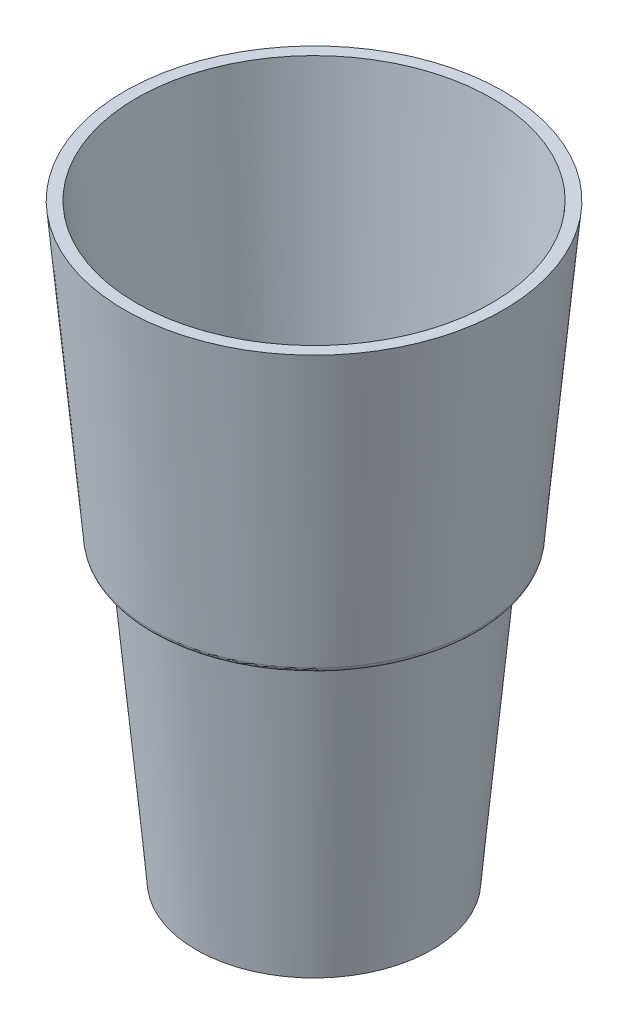
from build123d import *

# Parameters (mm, degrees)
FILLET1_R = 1.27
SHELL1_T  = -2.54


with BuildPart() as part:
    # Sketch1 → Revolve2 (revolve)
    with BuildSketch(Plane.XY):
        Polygon((0, 0), (25.4, 0), (31.185877256, 63.5), (34.995877256, 63.5), (40.781754513, 127), (0, 127), align=None)
    revolve(axis=Axis((0, 0, 0), (0, 1, 0)))

    # Fillet1
    fillet1_edges = [part.edges().sort_by_distance(p)[0] for p in [
        (-34.995877256, 63.5, 0),
        (-31.185877256, 63.5, 0),
    ]]
    fillet(fillet1_edges, radius=FILLET1_R)

    # Shell1
    shell1_openings = [part.faces().sort_by_distance(p)[0] for p in [
        (0, 127, 0),
    ]]
    offset(amount=SHELL1_T, openings=shell1_openings, kind=Kind.INTERSECTION)


solid = part.part
